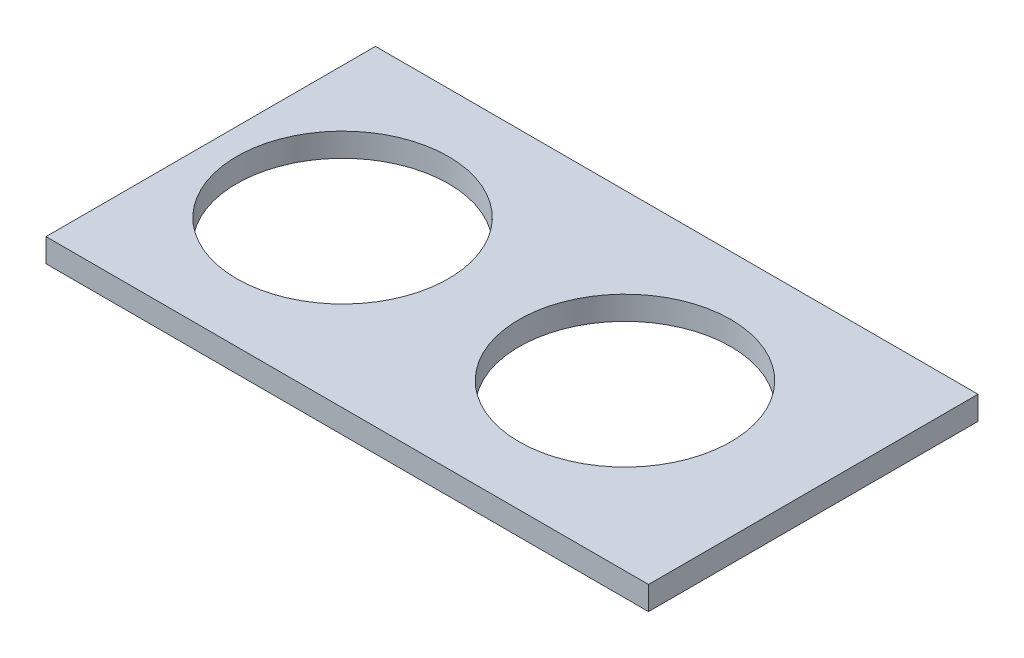
from build123d import *

# Parameters (mm, degrees)
SKETCH1_W           = 81.28
SKETCH1_H           = 44.45
SKETCH1_R           = 14.2875
BOSS_EXTRUDE1_DEPTH = 3.175


with BuildPart() as part:
    # Sketch1 → Boss-Extrude1 (new body)
    with BuildSketch(Plane(origin=(0, 0, 0), x_dir=(1, 0, 0), z_dir=(0, 1, 0))):
        with Locations((22.86, 0)):
            Rectangle(SKETCH1_W, SKETCH1_H)
        Circle(SKETCH1_R, mode=Mode.SUBTRACT)
        with Locations((38.1, 0)):
            Circle(SKETCH1_R, mode=Mode.SUBTRACT)
    extrude(amount=BOSS_EXTRUDE1_DEPTH)


solid = part.part
